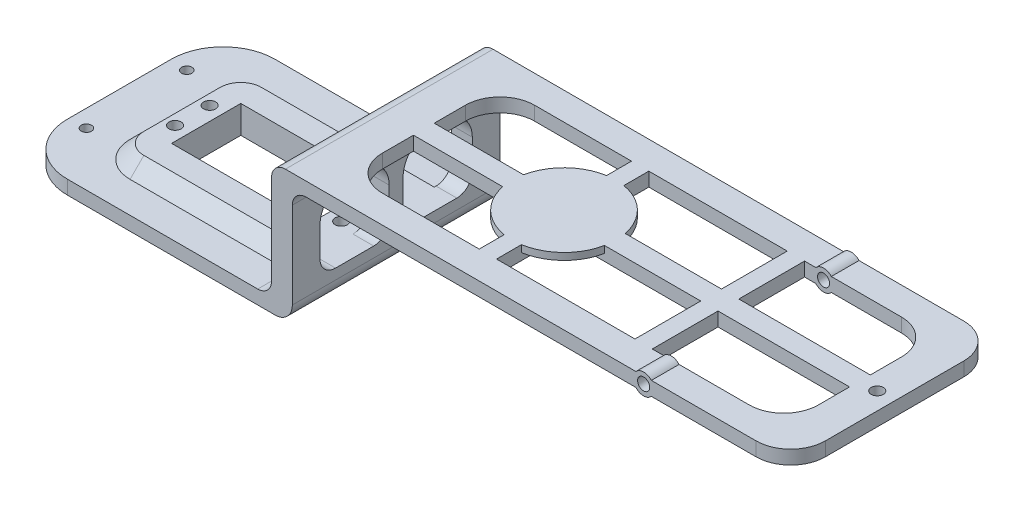
from build123d import *

# Parameters (mm, degrees)
Y_KSEKLIK_EKSTR_ZYON1_DEPTH     = 60
KES_EKSTR_ZYON1_DEPTH           = 60
IZIM3_R                         = 1.5
KES_EKSTR_ZYON2_DEPTH           = 60
RADYUS1_R                       = 15
RADYUS2_R                       = 5
IZIM4_R                         = 1.75
IZIM4_W                         = 40
IZIM4_H                         = 20
KES_EKSTR_ZYON3_DEPTH           = 60
Y_KSEKLIK_EKSTR_ZYON2_START     = 4
IZIM5_R                         = 1.75
IZIM5_R_2                       = 1.5
IZIM5_W                         = 40
IZIM5_H                         = 20
Y_KSEKLIK_EKSTR_ZYON2_DEPTH     = 4
PAH1_SIZE                       = 4
RADYUS3_R                       = 4
KES_EKSTR_ZYON4_DEPTH           = 4
Y_KSEKLIK_EKSTR_ZYON3_START     = -4
Y_KSEKLIK_EKSTR_ZYON3_OUTLINE_W = 5
Y_KSEKLIK_EKSTR_ZYON3_OUTLINE_H = 19
Y_KSEKLIK_EKSTR_ZYON3_DEPTH     = 4
IZIM8_R                         = 15
Y_KSEKLIK_EKSTR_ZYON4_DEPTH     = 2
Y_KSEKLIK_EKSTR_ZYON5_START     = -8
Y_KSEKLIK_EKSTR_ZYON5_DEPTH     = 8
IZIM10_R                        = 1.75
KES_EKSTR_ZYON5_DEPTH           = 10
Y_KSEKLIK_EKSTR_ZYON6_START     = -8
Y_KSEKLIK_EKSTR_ZYON6_DEPTH     = 8
KES_EKSTR_ZYON6_START           = -10
IZIM12_R                        = 1.75
KES_EKSTR_ZYON6_DEPTH           = 10
IZIM13_R                        = 1.75
KES_EKSTR_ZYON7_DEPTH           = 10
RADYUS4_R                       = 10


# Read off the part's stored shape, not the designer's step: Yükseklik-Ekstrüzyon3, Yükseklik-Ekstrüzyon5, Yükseklik-Ekstrüzyon6
with BuildPart() as part:
    # Çizim1 → Yükseklik-Ekstrüzyon1 (new body)
    with BuildSketch(Plane.XY):
        with BuildLine():
            Line((0, 0), (80, 0))
            Line((80, 0), (80, 30))
            ThreePointArc((80, 30), (81.171572875, 32.828427125), (84, 34))
            Line((84, 34), (224, 34))
            Line((224, 34), (224, 38))
            Line((224, 38), (78, 38))
            ThreePointArc((78, 38), (75.171572875, 36.828427125), (74, 34))
            Line((74, 34), (74, 4))
            Line((74, 4), (0, 4))
            Line((0, 4), (0, 0))
        make_face()
    extrude(amount=Y_KSEKLIK_EKSTR_ZYON1_DEPTH)

    # Çizim2 → Kes-Ekstrüzyon1 (cut)
    with BuildSketch(Plane.ZY.offset(-74)):
        with BuildLine():
            Line((16, 29), (20, 29))
            ThreePointArc((20, 29), (25.656854249, 26.656854249), (28, 21))
            Line((28, 21), (28, 12.482548154))
            ThreePointArc((28, 12.482548154), (26.687092043, 9.312907957), (23.517451846, 8))
            Line((23.517451846, 8), (12.482548154, 8))
            ThreePointArc((12.482548154, 8), (9.312907957, 9.312907957), (8, 12.482548154))
            Line((8, 12.482548154), (8, 21))
            ThreePointArc((8, 21), (10.343145751, 26.656854249), (16, 29))
        make_face()
        with BuildLine():
            Line((32, 21), (32, 12.482548154))
            ThreePointArc((32, 12.482548154), (33.312907957, 9.312907957), (36.482548154, 8))
            Line((36.482548154, 8), (47.517451846, 8))
            ThreePointArc((47.517451846, 8), (50.687092043, 9.312907957), (52, 12.482548154))
            Line((52, 12.482548154), (52, 21))
            ThreePointArc((52, 21), (49.656854249, 26.656854249), (44, 29))
            Line((44, 29), (40, 29))
            ThreePointArc((40, 29), (34.343145751, 26.656854249), (32, 21))
        make_face()
    extrude(amount=-KES_EKSTR_ZYON1_DEPTH, mode=Mode.SUBTRACT)

    # Çizim3 → Kes-Ekstrüzyon2 (cut)
    with BuildSketch(Plane(origin=(0, 4, 0), x_dir=(1, 0, 0), z_dir=(0, 1, 0))):
        with Locations(Location((5, -15.5, 0), (0, 0, 180))):
            Circle(IZIM3_R)
        with Locations(Location((5, -44.5, 0), (0, 0, 180))):
            Circle(IZIM3_R)
        with Locations(Location((65, -15.5, 0), (0, 0, 180))):
            Circle(IZIM3_R)
        with Locations(Location((65, -44.5, 0), (0, 0, 180))):
            Circle(IZIM3_R)
    extrude(amount=-KES_EKSTR_ZYON2_DEPTH, mode=Mode.SUBTRACT)

    # Radyus1
    radyus1_edges = [part.edges().sort_by_distance(p)[0] for p in [
        (0, 2, 0),
        (0, 2, 60),
    ]]
    fillet(radyus1_edges, radius=RADYUS1_R)

    # Radyus2
    radyus2_edges = [part.edges().sort_by_distance(p)[0] for p in [
        (80, 0, 30),
    ]]
    fillet(radyus2_edges, radius=RADYUS2_R)

    # Çizim4 → Kes-Ekstrüzyon3 (cut)
    with BuildSketch(Plane(origin=(0, 4, 0), x_dir=(1, 0, 0), z_dir=(0, 1, 0))):
        with Locations(Location((21.11, -25, 0), (0, 0, 180))):
            Circle(IZIM4_R)
        with Locations(Location((21.11, -35, 0), (0, 0, 180))):
            Circle(IZIM4_R)
        with Locations(Location((69.11, -25, 0), (0, 0, 180))):
            Circle(IZIM4_R)
        with Locations(Location((69.11, -35, 0), (0, 0, 180))):
            Circle(IZIM4_R)
        with Locations((45.11, -30)):
            Rectangle(IZIM4_W, IZIM4_H)
    extrude(amount=-KES_EKSTR_ZYON3_DEPTH, mode=Mode.SUBTRACT)

    # Çizim5 → Yükseklik-Ekstrüzyon2 (add)
    with BuildSketch(Plane(origin=(0, 4, 0), x_dir=(1, 0, 0), z_dir=(0, 1, 0)).offset(Y_KSEKLIK_EKSTR_ZYON2_START)):
        with BuildLine():
            Line((24.11, -13), (74, -13))
            Line((74, -13), (74, -47))
            Line((74, -47), (24.11, -47))
            ThreePointArc((24.11, -47), (19.867359313, -45.242640687), (18.11, -41))
            Line((18.11, -41), (18.11, -19))
            ThreePointArc((18.11, -19), (19.867359313, -14.757359313), (24.11, -13))
        make_face()
        with Locations(Location((21.11, -25, 0), (0, 0, 180))):
            Circle(IZIM5_R, mode=Mode.SUBTRACT)
        with Locations(Location((21.11, -35, 0), (0, 0, 180))):
            Circle(IZIM5_R, mode=Mode.SUBTRACT)
        with Locations(Location((65, -44.5, 0), (0, 0, 180))):
            Circle(IZIM5_R_2, mode=Mode.SUBTRACT)
        with Locations(Location((69.11, -25, 0), (0, 0, 180))):
            Circle(IZIM5_R, mode=Mode.SUBTRACT)
        with Locations(Location((69.11, -35, 0), (0, 0, 180))):
            Circle(IZIM5_R, mode=Mode.SUBTRACT)
        with Locations(Location((65, -15.5, 0), (0, 0, 180))):
            Circle(IZIM5_R_2, mode=Mode.SUBTRACT)
        with Locations((45.11, -30)):
            Rectangle(IZIM5_W, IZIM5_H, mode=Mode.SUBTRACT)
    extrude(amount=-Y_KSEKLIK_EKSTR_ZYON2_DEPTH)

    # Pah1
    pah1_edges = [part.edges().sort_by_distance(p)[0] for p in [
        (49.055, 4, 13),
        (19.867359313, 4, 14.757359313),
        (18.11, 4, 30),
        (19.867359313, 4, 45.242640687),
        (49.055, 4, 47),
    ]]
    chamfer(pah1_edges, length=PAH1_SIZE - 0.0001)  # a hair under: the kernel refuses the full size

    # Radyus3
    radyus3_edges = [part.edges().sort_by_distance(p)[0] for p in [
        (74, 4, 55.49995),
        (74, 4, 4.50005),
    ]]
    fillet(radyus3_edges, radius=RADYUS3_R - 0.0001)  # a hair under: the kernel refuses the full size

    # Çizim6 → Kes-Ekstrüzyon4 (cut)
    with BuildSketch(Plane(origin=(0, 38, 0), x_dir=(1, 0, 0), z_dir=(0, 1, 0))):
        with BuildLine():
            Line((204, -52), (98, -52))
            ThreePointArc((98, -52), (90.928932188, -49.071067812), (88, -42))
            Line((88, -42), (88, -33))
            Line((88, -33), (214, -33))
            Line((214, -33), (214, -42))
            ThreePointArc((214, -42), (211.071067812, -49.071067812), (204, -52))
        make_face()
        with BuildLine():
            Line((204, -8), (98, -8))
            ThreePointArc((98, -8), (90.928932188, -10.928932188), (88, -18))
            Line((88, -18), (88, -27))
            Line((88, -27), (214, -27))
            Line((214, -27), (214, -18))
            ThreePointArc((214, -18), (211.071067812, -10.928932188), (204, -8))
        make_face()
    extrude(amount=-KES_EKSTR_ZYON4_DEPTH, mode=Mode.SUBTRACT)

    # Yükseklik-Ekstrüzyon3 outline → Yükseklik-Ekstrüzyon3 (add)
    with BuildSketch(Plane(origin=(0, 38, 0), x_dir=(1, 0, 0), z_dir=(0, 1, 0)).offset(Y_KSEKLIK_EKSTR_ZYON3_START)):
        with Locations((173.5, -42.5)):
            Rectangle(Y_KSEKLIK_EKSTR_ZYON3_OUTLINE_W, Y_KSEKLIK_EKSTR_ZYON3_OUTLINE_H)
        with Locations((128.5, -42.5)):
            Rectangle(Y_KSEKLIK_EKSTR_ZYON3_OUTLINE_W, Y_KSEKLIK_EKSTR_ZYON3_OUTLINE_H)
        with Locations((173.5, -17.5)):
            Rectangle(Y_KSEKLIK_EKSTR_ZYON3_OUTLINE_W, Y_KSEKLIK_EKSTR_ZYON3_OUTLINE_H)
        with Locations((128.5, -17.5)):
            Rectangle(Y_KSEKLIK_EKSTR_ZYON3_OUTLINE_W, Y_KSEKLIK_EKSTR_ZYON3_OUTLINE_H)
    extrude(amount=Y_KSEKLIK_EKSTR_ZYON3_DEPTH)

    # Çizim8 → Yükseklik-Ekstrüzyon4 (add)
    with BuildSketch(Plane(origin=(0, 38, 0), x_dir=(1, 0, 0), z_dir=(0, 1, 0))):
        with Locations((128.5, -30)):
            Circle(IZIM8_R)
    extrude(amount=-Y_KSEKLIK_EKSTR_ZYON4_DEPTH)

    # Yükseklik-Ekstrüzyon5 outline → Yükseklik-Ekstrüzyon5 (add)
    with BuildSketch(Plane.XY.offset(60).offset(Y_KSEKLIK_EKSTR_ZYON5_START)):
        with BuildLine():
            Line((179.263932023, 38), (183.736067977, 38))
            ThreePointArc((183.736067977, 38), (181.5, 39), (179.263932023, 38))
        make_face()
        with BuildLine():
            Line((183.736067977, 34), (179.263932023, 34))
            ThreePointArc((179.263932023, 34), (181.5, 33), (183.736067977, 34))
        make_face()
    extrude(amount=Y_KSEKLIK_EKSTR_ZYON5_DEPTH)

    # Çizim10 → Kes-Ekstrüzyon5 (cut)
    with BuildSketch(Plane.XY.offset(60)):
        with Locations((181.5, 36)):
            Circle(IZIM10_R)
    extrude(amount=-KES_EKSTR_ZYON5_DEPTH, mode=Mode.SUBTRACT)

    # Yükseklik-Ekstrüzyon6 outline → Yükseklik-Ekstrüzyon6 (add)
    with BuildSketch(Plane(origin=(0, 0, 0), x_dir=(-1, 0, 0), z_dir=(0, 0, -1)).offset(Y_KSEKLIK_EKSTR_ZYON6_START)):
        with BuildLine():
            Line((-183.736067977, 38), (-179.263932023, 38))
            ThreePointArc((-179.263932023, 38), (-181.5, 39), (-183.736067977, 38))
        make_face()
        with BuildLine():
            Line((-179.263932023, 34), (-183.736067977, 34))
            ThreePointArc((-183.736067977, 34), (-181.5, 33), (-179.263932023, 34))
        make_face()
    extrude(amount=Y_KSEKLIK_EKSTR_ZYON6_DEPTH)

    # Çizim12 → Kes-Ekstrüzyon6 (cut)
    with BuildSketch(Plane(origin=(0, 0, 0), x_dir=(-1, 0, 0), z_dir=(0, 0, -1)).offset(KES_EKSTR_ZYON6_START)):
        with Locations(Location((-181.5, 36, 0), (0, 0, 180))):
            Circle(IZIM12_R)
    extrude(amount=KES_EKSTR_ZYON6_DEPTH, mode=Mode.SUBTRACT)

    # Çizim13 → Kes-Ekstrüzyon7 (cut)
    with BuildSketch(Plane(origin=(0, 38, 0), x_dir=(1, 0, 0), z_dir=(0, 1, 0))):
        with Locations(Location((219, -30, 0), (0, 0, 180))):
            Circle(IZIM13_R)
    extrude(amount=-KES_EKSTR_ZYON7_DEPTH, mode=Mode.SUBTRACT)

    # Radyus4
    radyus4_edges = [part.edges().sort_by_distance(p)[0] for p in [
        (224, 36, 0),
        (224, 36, 60),
    ]]
    fillet(radyus4_edges, radius=RADYUS4_R)


solid = part.part
